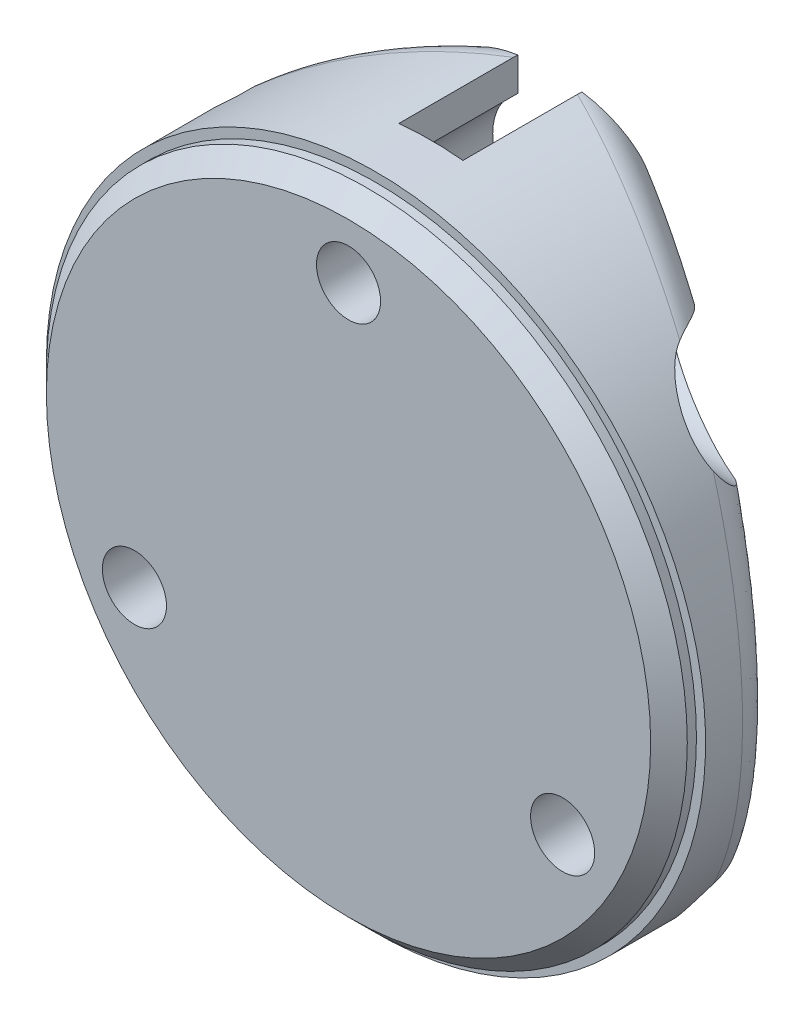
from build123d import *

# Parameters (mm, degrees)
SKETCH1_R               = 17.5
BOSS_EXTRUDE1_DEPTH     = 1.5
SKETCH2_R               = 18
BOSS_EXTRUDE2_DEPTH     = 3
CHAMFER1_SIZE           = 1
BOSS_EXTRUDE3_DEPTH     = 20
CUT_EXTRUDE1_DEPTH      = 29.853076093
CUT_EXTRUDE1_DEPTH_BACK = 29.853076093
SKETCH4_R               = 1.5
CUT_EXTRUDE2_DEPTH      = 30.381116385
CUT_EXTRUDE2_DEPTH_BACK = 30.381116385
SKETCH6_W               = 46.724377104
SKETCH6_H               = 45.890013228
SKETCH6_R               = 18
SKETCH7_W               = 3.5
SKETCH7_H               = 14
CUT_EXTRUDE3_DEPTH      = 3
CUT_EXTRUDE4_START      = 6
SKETCH8_R               = 2.75
CUT_EXTRUDE4_DEPTH      = 33
CUT_EXTRUDE5_START      = -5
CUT_EXTRUDE5_DEPTH      = 33
FILLET1_R               = 2
SKETCH10_R              = 1.75
CUT_EXTRUDE6_DEPTH      = 28.730849417
SKETCH12_R              = 3.125
CUT_EXTRUDE7_DEPTH      = 6
CUT_EXTRUDE8_START      = -6
SKETCH13_R              = 31.5
CUT_EXTRUDE8_DEPTH      = 22


with BuildPart() as part:
    # Sketch1 → Boss-Extrude1 (new body)
    with BuildSketch(Plane.XY):
        Circle(SKETCH1_R)
    extrude(amount=BOSS_EXTRUDE1_DEPTH)

    # Sketch2 → Boss-Extrude2 (add)
    with BuildSketch(Plane(origin=(0, 0, 0), x_dir=(-1, 0, 0), z_dir=(0, 0, -1))):
        Circle(SKETCH2_R)
    extrude(amount=BOSS_EXTRUDE2_DEPTH)

    # Chamfer1
    chamfer1_edges = [part.edges().sort_by_distance(p)[0] for p in [
        (-17.5, 0, 1.5),
    ]]
    chamfer(chamfer1_edges, length=CHAMFER1_SIZE)

    # Sketch3 → Boss-Extrude3 (add, symmetric)
    with BuildSketch(Plane(origin=(0, 0, 0), x_dir=(1, 0, 0), z_dir=(0, 1, 0))):
        Polygon((-18.5, 3), (-5.523971877, 9.5), (-1.75, 9.5), (-1.75, 3), align=None)
        Polygon((18.5, 3), (1.75, 3), (1.75, 9.5), (5.523971877, 9.5), align=None)
    extrude(amount=BOSS_EXTRUDE3_DEPTH, both=True)

    # Sketch4 → Cut-Extrude1 (cut, two sides: drawn at the far end of the back side and taken through both)
    with BuildSketch(Plane(origin=(0, 0, 0), x_dir=(0, 0, -1), z_dir=(1, 0, 0)).offset(-CUT_EXTRUDE1_DEPTH_BACK)):
        with Locations((5.75, 11)):
            Circle(SKETCH4_R)
        with Locations((5.75, -11)):
            Circle(SKETCH4_R)
    extrude(amount=CUT_EXTRUDE1_DEPTH + CUT_EXTRUDE1_DEPTH_BACK, mode=Mode.SUBTRACT)

    # Sketch6 → Cut-Extrude2 (cut, two sides: drawn at the far end of the back side and taken through both)
    with BuildSketch(Plane.XY.offset(1.5).offset(-CUT_EXTRUDE2_DEPTH_BACK)):
        Rectangle(SKETCH6_W, SKETCH6_H)
        Circle(SKETCH6_R, mode=Mode.SUBTRACT)
    extrude(amount=CUT_EXTRUDE2_DEPTH + CUT_EXTRUDE2_DEPTH_BACK, mode=Mode.SUBTRACT)

    # Sketch7 → Cut-Extrude3 (cut)
    with BuildSketch(Plane(origin=(0, 0, -3), x_dir=(-1, 0, 0), z_dir=(0, 0, -1))):
        Rectangle(SKETCH7_W, SKETCH7_H)
    extrude(amount=-CUT_EXTRUDE3_DEPTH, mode=Mode.SUBTRACT)

    # Sketch8 → Cut-Extrude4 (cut)
    with BuildSketch(Plane(origin=(0, 0, 0), x_dir=(0, 0, -1), z_dir=(1, 0, 0)).offset(CUT_EXTRUDE4_START)):
        with Locations((5.75, 11)):
            Circle(SKETCH8_R)
        with Locations((5.75, -11)):
            Circle(SKETCH8_R)
    extrude(amount=CUT_EXTRUDE4_DEPTH, mode=Mode.SUBTRACT)

    # Sketch9 → Cut-Extrude5 (cut)
    with BuildSketch(Plane(origin=(0, 0, 0), x_dir=(0, 0, -1), z_dir=(1, 0, 0)).offset(CUT_EXTRUDE5_START)):
        Polygon((7.33771324, 8.25), (8.925426481, 11), (7.33771324, 13.75), (4.16228676, 13.75), (2.574573519, 11), (4.16228676, 8.25), align=None)
        Polygon((4.16228676, -13.75), (7.33771324, -13.75), (8.925426481, -11), (7.33771324, -8.25), (4.16228676, -8.25), (2.574573519, -11), align=None)
    extrude(amount=-CUT_EXTRUDE5_DEPTH, mode=Mode.SUBTRACT)

    # Fillet1
    fillet1_edges = [part.edges().sort_by_distance(p)[0] for p in [
        (8.760799421, 15.72413411, -7.878596375),
        (17.432239539, -4.485200627, -3.53486652),
        (8.760799421, -15.72413411, -7.878596375),
        (-8.708921407, -15.752926329, -7.904583302),
        (-8.708921407, 15.752926329, -7.904583302),
        (-18, 0, -3.250461849),
    ]]
    fillet(fillet1_edges, radius=FILLET1_R)

    # Sketch10 → Cut-Extrude6 (cut, through all)
    with BuildSketch(Plane.XY.offset(1.5)):
        with Locations((0, 13.5)):
            Circle(SKETCH10_R)
        with Locations((11.691342951, -6.75)):
            Circle(SKETCH10_R)
        with Locations((-11.691342951, -6.75)):
            Circle(SKETCH10_R)
    extrude(amount=-CUT_EXTRUDE6_DEPTH, mode=Mode.SUBTRACT)

    # Sketch12 → Cut-Extrude7 (cut)
    with BuildSketch(Plane(origin=(0, 0, -9.5), x_dir=(-1, 0, 0), z_dir=(0, 0, -1))):
        with Locations((-11.691342951, -6.75)):
            Circle(SKETCH12_R)
        with Locations((0, 13.5)):
            Circle(SKETCH12_R)
        with Locations((11.691342951, -6.75)):
            Circle(SKETCH12_R)
    extrude(amount=-CUT_EXTRUDE7_DEPTH, mode=Mode.SUBTRACT)

    # Sketch13 → Cut-Extrude8 (cut)
    with BuildSketch(Plane(origin=(0, 0, 0), x_dir=(0, 0, -1), z_dir=(1, 0, 0)).offset(CUT_EXTRUDE8_START)):
        with Locations((38, 0)):
            Circle(SKETCH13_R)
    extrude(amount=-CUT_EXTRUDE8_DEPTH, mode=Mode.SUBTRACT)


solid = part.part
